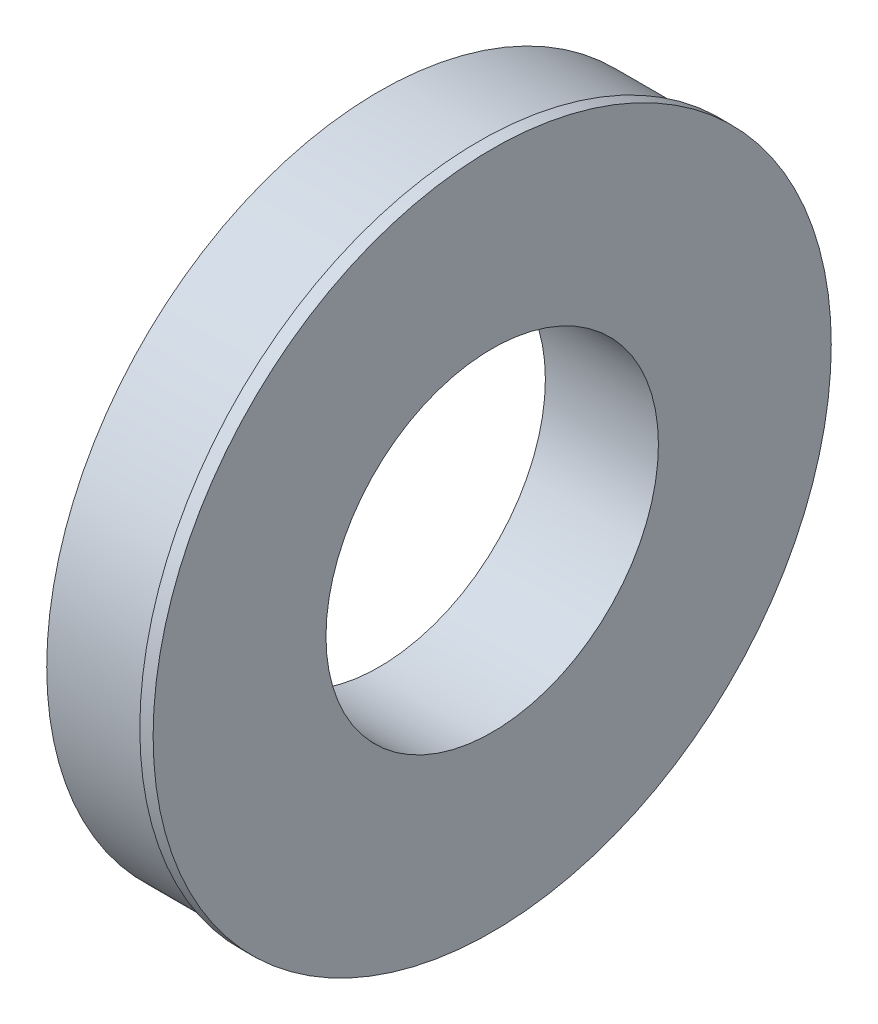
from build123d import *

# Parameters (mm, degrees)
SKETCH1_R           = 63.5
SKETCH1_R_2         = 31.75
BOSS_EXTRUDE1_DEPTH = 19.05
SKETCH2_R           = 64.77
SKETCH2_R_2         = 31.75
BOSS_EXTRUDE2_DEPTH = 2.54


with BuildPart() as part:
    # Sketch1 → Boss-Extrude1 (new body)
    with BuildSketch(Plane(origin=(0, 0, 0), x_dir=(0, 0, -1), z_dir=(1, 0, 0))):
        Circle(SKETCH1_R)
        Circle(SKETCH1_R_2, mode=Mode.SUBTRACT)
    extrude(amount=BOSS_EXTRUDE1_DEPTH)

    # Sketch2 → Boss-Extrude2 (add)
    with BuildSketch(Plane(origin=(19.05, 0, 0), x_dir=(0, 0, -1), z_dir=(1, 0, 0))):
        Circle(SKETCH2_R)
        Circle(SKETCH2_R_2, mode=Mode.SUBTRACT)
    extrude(amount=BOSS_EXTRUDE2_DEPTH)


solid = part.part
